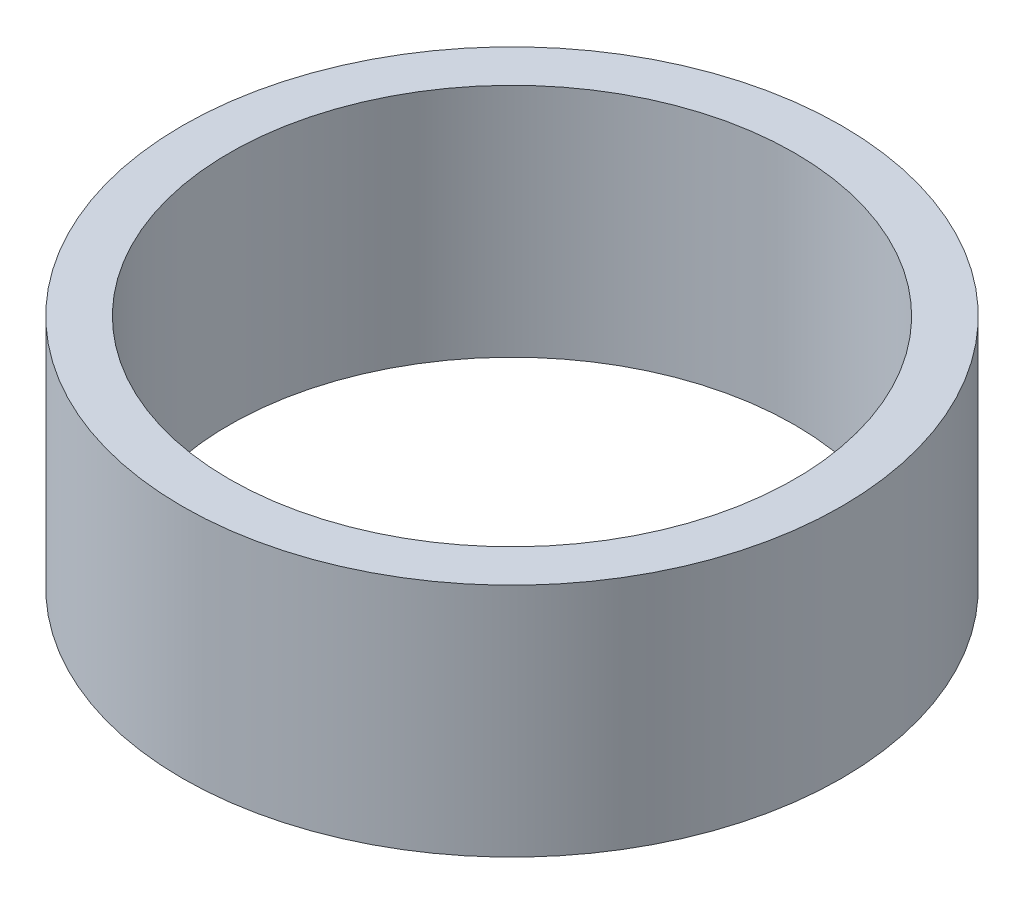
from build123d import *

# Parameters (mm, degrees)
SKETCH1_R           = 22.225
SKETCH1_R_2         = 19.05
BOSS_EXTRUDE1_DEPTH = 15.875


with BuildPart() as part:
    # Sketch1 → Boss-Extrude1 (new body)
    with BuildSketch(Plane(origin=(0, 0, 0), x_dir=(1, 0, 0), z_dir=(0, 1, 0))):
        Circle(SKETCH1_R)
        Circle(SKETCH1_R_2, mode=Mode.SUBTRACT)
    extrude(amount=BOSS_EXTRUDE1_DEPTH)


solid = part.part
